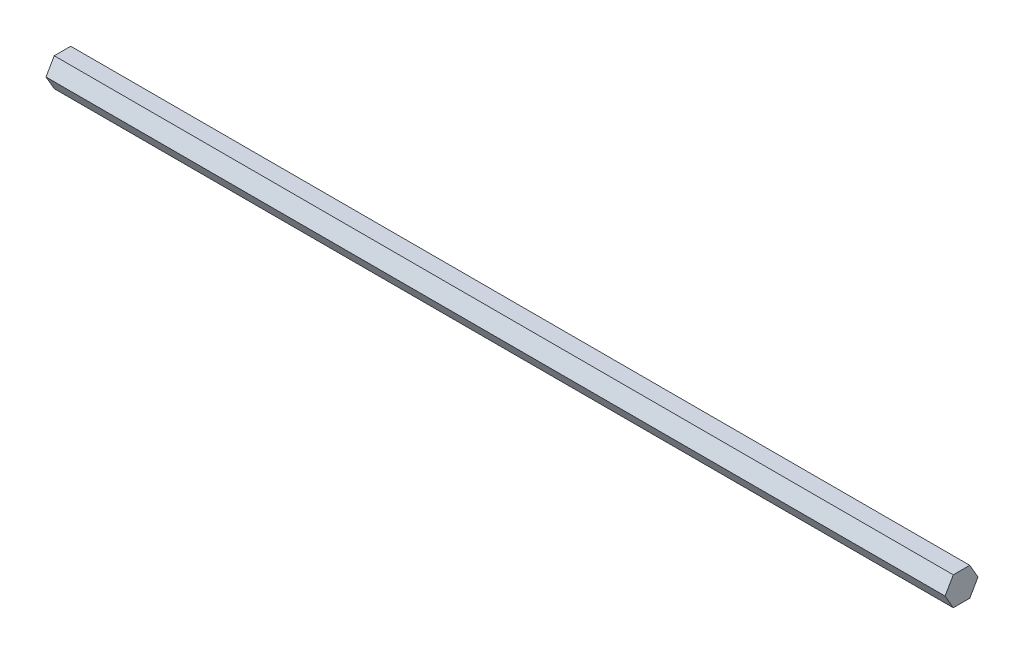
from build123d import *

# Parameters (mm, degrees)
BOSS_EXTRUDE1_DEPTH = 200.025


with BuildPart() as part:
    # Sketch1 → Boss-Extrude1 (new, symmetric)
    with BuildSketch(Plane(origin=(0, 0, 0), x_dir=(0, 0, -1), z_dir=(1, 0, 0))):
        Polygon((7.332348419, 0), (3.666174209, 6.35), (-3.666174209, 6.35), (-7.332348419, 0), (-3.666174209, -6.35), (3.666174209, -6.35), align=None)
    extrude(amount=BOSS_EXTRUDE1_DEPTH, both=True)


solid = part.part
